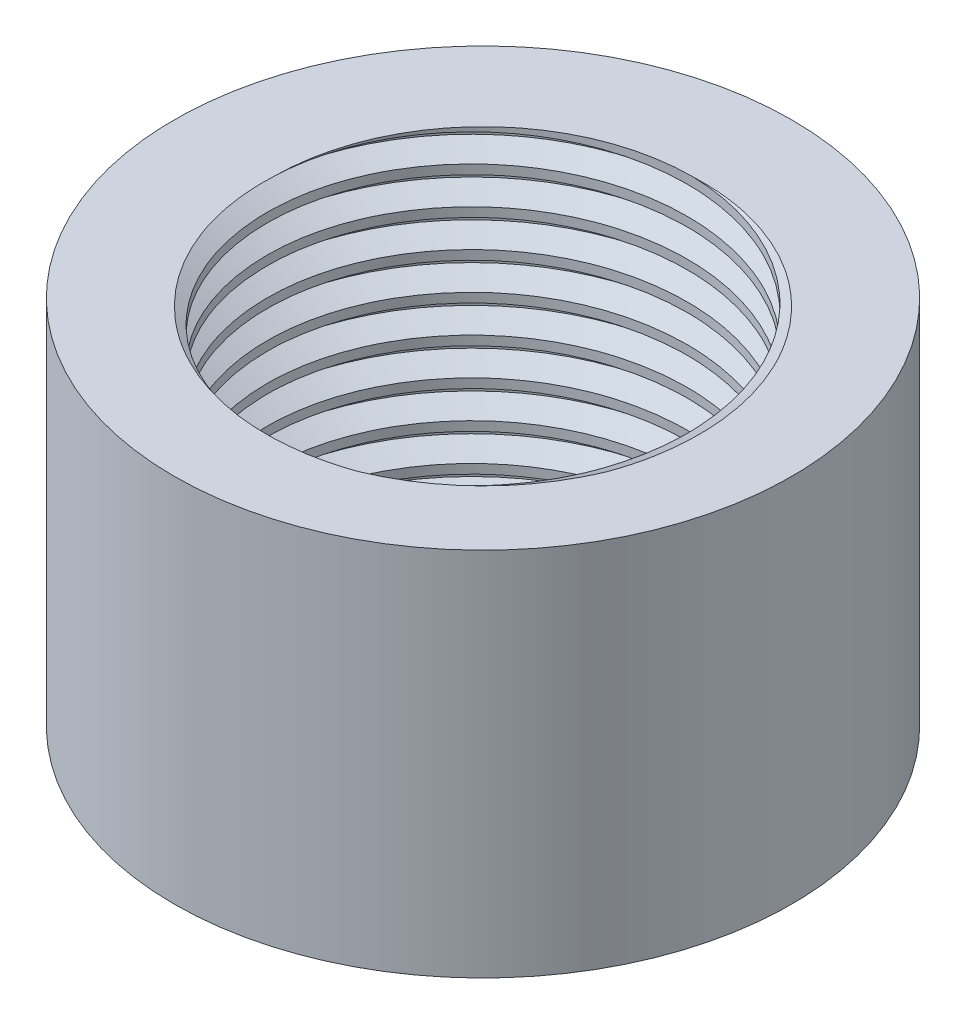
from build123d import *

# Parameters (mm, degrees)
SKETCH1_R           = 12.5
SKETCH1_R_2         = 8.5
BOSS_EXTRUDE1_DEPTH = 15
THREAD1_PITCH       = 1.5


with BuildPart() as part:
    # Sketch1 → Boss-Extrude1 (new body)
    with BuildSketch(Plane(origin=(0, 0, 0), x_dir=(1, 0, 0), z_dir=(0, 1, 0))):
        with Locations(Location((0, 0, 0), (0, 0, 270))):
            Circle(SKETCH1_R)
        with Locations(Location((0, 0, 0), (0, 0, 270))):
            Circle(SKETCH1_R_2, mode=Mode.SUBTRACT)
    extrude(amount=BOSS_EXTRUDE1_DEPTH)

    # Thread1: the profile of Thread Profile1 profile screwed along a right-hand helix of 11 turns, 8 arcs to a turn; built about Z, then put on its axis
    thread1_z = Axis((0, 0, 0), (0, 0, 1))
    thread1_corners = [(8.4997, 0, -0.000173205), (9.311898813, 0, 0.468749998), (9.311898813, 0, 0.656249998), (8.4997, 0, 1.125173201)]
    with BuildLine(mode=Mode.PRIVATE) as thread1_profile:
        Line(thread1_corners[0], thread1_corners[1])
        Line(thread1_corners[1], thread1_corners[2])
        Line(thread1_corners[2], thread1_corners[3])
        Line(thread1_corners[3], thread1_corners[0])
    thread1_cap = Face(thread1_profile.wire())
    thread1_turn_angles = [0, 22.5, 45, 67.5, 90, 112.5, 135, 157.5, 180, 202.5, 225, 247.5, 270, 292.5, 315, 337.5, 360]
    thread1_turn_weights = [1, 0.9238795325112867, 1, 0.9238795325112867, 1, 0.9238795325112867, 1, 0.9238795325112867, 1, 0.9238795325112867, 1, 0.9238795325112867, 1, 0.9238795325112867, 1, 0.9238795325112867, 1]
    thread1_turn_rails = [Edge.make_bspline([Vector(p[0], p[1], 0).rotate(thread1_z, thread1_turn_angles[k]) / thread1_turn_weights[k] + Vector(0, 0, p[2] + THREAD1_PITCH * thread1_turn_angles[k] / 360) for k in range(17)], [0, 0, 0, 1, 1, 2, 2, 3, 3, 4, 4, 5, 5, 6, 6, 7, 7, 8, 8, 8], 2, thread1_turn_weights) for p in thread1_corners]
    thread1_turn_sides = [Face.make_surface_from_curves(thread1_turn_rails[p[0]], thread1_turn_rails[p[1]]) for p in [(0, 1), (1, 2), (2, 3), (3, 0)]]
    thread1 = Plane(origin=(0, 16.5, 0), x_dir=(-1, 0, 0), z_dir=(0, -1, 0)) * Solid(Shell([*[p.moved(Location((0, 0, THREAD1_PITCH * i))) for i in range(11) for p in thread1_turn_sides], thread1_cap, thread1_cap.rotate(thread1_z, 3960).moved(Location((0, 0, THREAD1_PITCH * 3960 / 360)))]))
    add(thread1, mode=Mode.SUBTRACT)


solid = part.part
